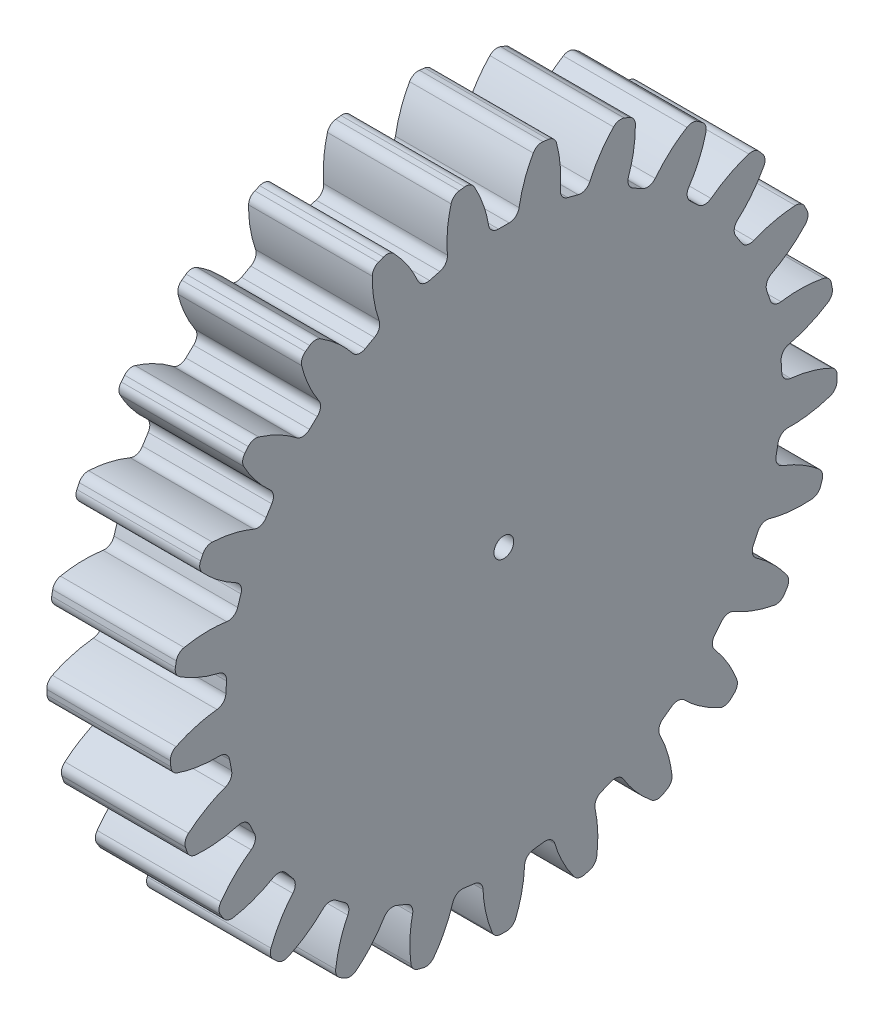
from build123d import *

# Parameters (mm, degrees)
METRIC_SPUR_GEAR_1M_25T_14_5PA_1FW_OUT_R = 0.4
METRIC_SPUR_GEAR_1M_25T_14_5PA_1FW_DEPTH = 1
ADD25_R                                  = 0.4
DED25A_R                                 = 0.4
DED25B_R                                 = 0.4
SCALE25_SCALE_X                          = 10
SCALE25_SCALE_Y                          = 2
SCALE25_SCALE_Z                          = 2


# Read off the part's stored shape, not the designer's step: Solid Bodies9
with BuildPart() as part:
    # Metric - Spur gear 1M 25T 14.5PA 1FW ---S25N75H50L0.8N out → Metric - Spur gear 1M 25T 14.5PA 1FW ---S25N75H50L0.8N (new body)
    with BuildSketch(Plane.YZ):
        with BuildLine():
            ThreePointArc((12.411863853, -5.309956279), (12.551982559, -4.969681461), (12.68277456, -4.62571394))
            ThreePointArc((12.68277456, -4.62571394), (11.786600969, -3.871668557), (10.739601079, -3.346784973))
            ThreePointArc((10.739601079, -3.346784973), (10.89559198, -2.79751254), (11.023510124, -2.241032249))
            ThreePointArc((11.023510124, -2.241032249), (12.193867716, -2.285469303), (13.342454754, -2.056429217))
            ThreePointArc((13.342454754, -2.056429217), (13.393548468, -1.691998653), (13.434690153, -1.326310856))
            ThreePointArc((13.434690153, -1.326310856), (12.379148042, -0.818824505), (11.23450834, -0.570809389))
            ThreePointArc((11.23450834, -0.570809389), (11.249, 0), (11.23450834, 0.570809389))
            ThreePointArc((11.23450834, 0.570809389), (12.379148042, 0.818824505), (13.434690153, 1.326310856))
            ThreePointArc((13.434690153, 1.326310856), (13.393548468, 1.691998653), (13.342454754, 2.056429217))
            ThreePointArc((13.342454754, 2.056429217), (12.193867716, 2.285469303), (11.023510124, 2.241032249))
            ThreePointArc((11.023510124, 2.241032249), (10.89559198, 2.79751254), (10.739601079, 3.346784973))
            ThreePointArc((10.739601079, 3.346784973), (11.786600969, 3.871668557), (12.68277456, 4.62571394))
            ThreePointArc((12.68277456, 4.62571394), (12.551982559, 4.969681461), (12.411863853, 5.309956279))
            ThreePointArc((12.411863853, 5.309956279), (11.242401836, 5.246158668), (10.119864226, 4.912061589))
            ThreePointArc((10.119864226, 4.912061589), (9.857573844, 5.41924708), (9.569885185, 5.91246975))
            ThreePointArc((9.569885185, 5.91246975), (10.453458409, 6.681241435), (11.133953598, 7.634466404))
            ThreePointArc((11.133953598, 7.634466404), (10.921729424, 7.935100906), (10.701389899, 8.229839259))
            ThreePointArc((10.701389899, 8.229839259), (9.584534502, 7.877212591), (8.580350039, 7.274448034))
            ThreePointArc((8.580350039, 7.274448034), (8.20016809, 7.700470395), (7.798858209, 8.106652307))
            ThreePointArc((7.798858209, 8.106652307), (8.463486612, 9.071007341), (8.885545383, 10.163517267))
            ThreePointArc((8.885545383, 10.163517267), (8.605223862, 10.401928777), (8.31850826, 10.632611172))
            ThreePointArc((8.31850826, 10.632611172), (7.324435615, 10.013312276), (6.501700904, 9.179754155))
            ThreePointArc((6.501700904, 9.179754155), (6.027515617, 9.497844834), (5.53780029, 9.791464086))
            ThreePointArc((5.53780029, 9.791464086), (5.941722825, 10.890808496), (6.078825673, 12.053956962))
            ThreePointArc((6.078825673, 12.053956962), (5.748020436, 12.215165208), (5.412944153, 12.36729702))
            ThreePointArc((5.412944153, 12.36729702), (4.604115502, 11.520238724), (4.014525989, 10.508262563))
            ThreePointArc((4.014525989, 10.508262563), (3.47613217, 10.698434752), (2.928782012, 10.861042166))
            ThreePointArc((2.928782012, 10.861042166), (3.04661874, 12.026300099), (2.89015099, 13.187002209))
            ThreePointArc((2.89015099, 13.187002209), (2.529647747, 13.260877885), (2.167264859, 13.324900113))
            ThreePointArc((2.167264859, 13.324900113), (1.594501878, 12.303306205), (1.275103642, 11.176498186))
            ThreePointArc((1.275103642, 11.176498186), (0.706330554, 11.226802668), (0.135737589, 11.248181022))
            ThreePointArc((0.135737589, 11.248181022), (-0.039915605, 12.406135037), (-0.48012251, 13.491459609))
            ThreePointArc((-0.48012251, 13.491459609), (-0.847672014, 13.473360834), (-1.214591658, 13.445250727))
            ThreePointArc((-1.214591658, 13.445250727), (-1.515300162, 12.313311709), (-1.544438156, 11.142473324))
            ThreePointArc((-1.544438156, 11.142473324), (-2.107852408, 11.049749283), (-2.665835727, 10.928555297))
            ThreePointArc((-2.665835727, 10.928555297), (-3.123941905, 12.006446884), (-3.820228146, 12.948198983))
            ThreePointArc((-3.820228146, 12.948198983), (-4.171729424, 12.83926297), (-4.520130914, 12.720786789))
            ThreePointArc((-4.520130914, 12.720786789), (-4.529890321, 11.549626552), (-4.266937225, 10.408325884))
            ThreePointArc((-4.266937225, 10.408325884), (-4.789591251, 10.178399513), (-5.299904779, 9.92224825))
            ThreePointArc((-5.299904779, 9.92224825), (-6.011679447, 10.852349517), (-6.920294798, 11.591355396))
            ThreePointArc((-6.920294798, 11.591355396), (-7.233661732, 11.398426994), (-7.54165372, 11.197029033))
            ThreePointArc((-7.54165372, 11.197029033), (-7.25985081, 10.060235883), (-6.721328936, 9.02018505))
            ThreePointArc((-6.721328936, 9.02018505), (-7.170382461, 8.667503468), (-7.600961322, 8.292489854))
            ThreePointArc((-7.600961322, 8.292489854), (-8.521681059, 9.016359118), (-9.585533877, 9.506184318))
            ThreePointArc((-9.585533877, 9.506184318), (-9.84107647, 9.24138593), (-10.089306687, 8.969720763))
            ThreePointArc((-10.089306687, 8.969720763), (-9.533648174, 7.938723595), (-8.75339483, 7.065272815))
            ThreePointArc((-8.75339483, 7.065272815), (-9.10063217, 6.611996303), (-9.424421511, 6.141683823))
            ThreePointArc((-9.424421511, 6.141683823), (-10.49623411, 6.613837715), (-11.648478609, 6.823704719))
            ThreePointArc((-11.648478609, 6.823704719), (-11.830140181, 6.503674601), (-12.003011409, 6.17881195))
            ThreePointArc((-12.003011409, 6.17881195), (-11.20841136, 5.318392106), (-10.235452734, 4.666423505))
            ThreePointArc((-10.235452734, 4.666423505), (-10.45905569, 4.141033093), (-10.655710636, 3.60497321))
            ThreePointArc((-10.655710636, 3.60497321), (-11.811270169, 3.795744565), (-12.97950659, 3.712466657))
            ThreePointArc((-12.97950659, 3.712466657), (-13.075872675, 3.357313477), (-13.16252278, 2.999665657))
            ThreePointArc((-13.16252278, 2.999665657), (-12.178908839, 2.363886482), (-11.0743795, 1.974365644))
            ThreePointArc((-11.0743795, 1.974365644), (-11.160298275, 1.409873545), (-11.217462273, 0.841748872))
            ThreePointArc((-11.217462273, 0.841748872), (-12.384160685, 0.739150824), (-13.494984437, 0.36796066))
            ThreePointArc((-13.494984437, 0.36796066), (-13.5, 0), (-13.494984437, -0.36796066))
            ThreePointArc((-13.494984437, -0.36796066), (-12.384160685, -0.739150824), (-11.217462273, -0.841748872))
            ThreePointArc((-11.217462273, -0.841748872), (-11.160298275, -1.409873545), (-11.0743795, -1.974365644))
            ThreePointArc((-11.0743795, -1.974365644), (-12.178908839, -2.363886482), (-13.16252278, -2.999665657))
            ThreePointArc((-13.16252278, -2.999665657), (-13.075872675, -3.357313477), (-12.97950659, -3.712466657))
            ThreePointArc((-12.97950659, -3.712466657), (-11.811270169, -3.795744565), (-10.655710636, -3.60497321))
            ThreePointArc((-10.655710636, -3.60497321), (-10.45905569, -4.141033093), (-10.235452734, -4.666423505))
            ThreePointArc((-10.235452734, -4.666423505), (-11.20841136, -5.318392106), (-12.003011409, -6.17881195))
            ThreePointArc((-12.003011409, -6.17881195), (-11.830140181, -6.503674601), (-11.648478609, -6.823704719))
            ThreePointArc((-11.648478609, -6.823704719), (-10.49623411, -6.613837715), (-9.424421511, -6.141683823))
            ThreePointArc((-9.424421511, -6.141683823), (-9.10063217, -6.611996303), (-8.75339483, -7.065272815))
            ThreePointArc((-8.75339483, -7.065272815), (-9.533648174, -7.938723595), (-10.089306687, -8.969720763))
            ThreePointArc((-10.089306687, -8.969720763), (-9.84107647, -9.24138593), (-9.585533877, -9.506184318))
            ThreePointArc((-9.585533877, -9.506184318), (-8.521681059, -9.016359118), (-7.600961322, -8.292489854))
            ThreePointArc((-7.600961322, -8.292489854), (-7.170382461, -8.667503468), (-6.721328936, -9.02018505))
            ThreePointArc((-6.721328936, -9.02018505), (-7.25985081, -10.060235883), (-7.54165372, -11.197029033))
            ThreePointArc((-7.54165372, -11.197029033), (-7.233661732, -11.398426994), (-6.920294798, -11.591355396))
            ThreePointArc((-6.920294798, -11.591355396), (-6.011679447, -10.852349517), (-5.299904779, -9.92224825))
            ThreePointArc((-5.299904779, -9.92224825), (-4.789591251, -10.178399513), (-4.266937225, -10.408325884))
            ThreePointArc((-4.266937225, -10.408325884), (-4.529890321, -11.549626552), (-4.520130914, -12.720786789))
            ThreePointArc((-4.520130914, -12.720786789), (-4.171729424, -12.83926297), (-3.820228146, -12.948198983))
            ThreePointArc((-3.820228146, -12.948198983), (-3.123941905, -12.006446884), (-2.665835727, -10.928555297))
            ThreePointArc((-2.665835727, -10.928555297), (-2.107852408, -11.049749283), (-1.544438156, -11.142473324))
            ThreePointArc((-1.544438156, -11.142473324), (-1.515300162, -12.313311709), (-1.214591658, -13.445250727))
            ThreePointArc((-1.214591658, -13.445250727), (-0.847672014, -13.473360834), (-0.48012251, -13.491459609))
            ThreePointArc((-0.48012251, -13.491459609), (-0.039915605, -12.406135037), (0.135737589, -11.248181022))
            ThreePointArc((0.135737589, -11.248181022), (0.706330554, -11.226802668), (1.275103642, -11.176498186))
            ThreePointArc((1.275103642, -11.176498186), (1.594501878, -12.303306205), (2.167264859, -13.324900113))
            ThreePointArc((2.167264859, -13.324900113), (2.529647747, -13.260877885), (2.89015099, -13.187002209))
            ThreePointArc((2.89015099, -13.187002209), (3.04661874, -12.026300099), (2.928782012, -10.861042166))
            ThreePointArc((2.928782012, -10.861042166), (3.47613217, -10.698434752), (4.014525989, -10.508262563))
            ThreePointArc((4.014525989, -10.508262563), (4.604115502, -11.520238724), (5.412944153, -12.36729702))
            ThreePointArc((5.412944153, -12.36729702), (5.748020436, -12.215165208), (6.078825673, -12.053956962))
            ThreePointArc((6.078825673, -12.053956962), (5.941722825, -10.890808496), (5.53780029, -9.791464086))
            ThreePointArc((5.53780029, -9.791464086), (6.027515617, -9.497844834), (6.501700904, -9.179754155))
            ThreePointArc((6.501700904, -9.179754155), (7.324435615, -10.013312276), (8.31850826, -10.632611172))
            ThreePointArc((8.31850826, -10.632611172), (8.605223862, -10.401928777), (8.885545383, -10.163517267))
            ThreePointArc((8.885545383, -10.163517267), (8.463486612, -9.071007341), (7.798858209, -8.106652307))
            ThreePointArc((7.798858209, -8.106652307), (8.20016809, -7.700470395), (8.580350039, -7.274448034))
            ThreePointArc((8.580350039, -7.274448034), (9.584534502, -7.877212591), (10.701389899, -8.229839259))
            ThreePointArc((10.701389899, -8.229839259), (10.921729424, -7.935100906), (11.133953598, -7.634466404))
            ThreePointArc((11.133953598, -7.634466404), (10.453458409, -6.681241435), (9.569885185, -5.91246975))
            ThreePointArc((9.569885185, -5.91246975), (9.857573844, -5.41924708), (10.119864226, -4.912061589))
            ThreePointArc((10.119864226, -4.912061589), (11.242401836, -5.246158668), (12.411863853, -5.309956279))
        make_face()
        Circle(METRIC_SPUR_GEAR_1M_25T_14_5PA_1FW_OUT_R, mode=Mode.SUBTRACT)
    extrude(amount=METRIC_SPUR_GEAR_1M_25T_14_5PA_1FW_DEPTH)

    # Add25
    add25_edges = [part.edges().sort_by_distance(p)[0] for p in [
        (0.5, 5.412944153, 12.36729702),
        (0.5, 2.89015099, 13.187002209),
        (0.5, 2.167264859, 13.324900113),
        (0.5, -0.48012251, 13.491459609),
        (0.5, -1.214591658, 13.445250727),
        (0.5, -3.820228146, 12.948198983),
        (0.5, 13.434690153, -1.326310856),
        (0.5, 13.434690153, 1.326310856),
        (0.5, -4.520130914, 12.720786789),
        (0.5, -6.920294798, 11.591355396),
        (0.5, -7.54165372, 11.197029033),
        (0.5, -9.585533877, 9.506184318),
        (0.5, -10.089306687, 8.969720763),
        (0.5, -11.648478609, 6.823704719),
        (0.5, -12.003011409, 6.17881195),
        (0.5, -12.97950659, 3.712466657),
        (0.5, -13.16252278, 2.999665657),
        (0.5, -13.494984437, 0.36796066),
        (0.5, -13.494984437, -0.36796066),
        (0.5, -13.16252278, -2.999665657),
        (0.5, -12.97950659, -3.712466657),
        (0.5, -12.003011409, -6.17881195),
        (0.5, -11.648478609, -6.823704719),
        (0.5, -10.089306687, -8.969720763),
        (0.5, -9.585533877, -9.506184318),
        (0.5, -7.54165372, -11.197029033),
        (0.5, -6.920294798, -11.591355396),
        (0.5, -4.520130914, -12.720786789),
        (0.5, 13.342454754, 2.056429217),
        (0.5, -3.820228146, -12.948198983),
        (0.5, -1.214591658, -13.445250727),
        (0.5, 12.68277456, 4.62571394),
        (0.5, -0.48012251, -13.491459609),
        (0.5, 2.167264859, -13.324900113),
        (0.5, 2.89015099, -13.187002209),
        (0.5, 5.412944153, -12.36729702),
        (0.5, 6.078825673, -12.053956962),
        (0.5, 8.31850826, -10.632611172),
        (0.5, 8.885545383, -10.163517267),
        (0.5, 10.701389899, -8.229839259),
        (0.5, 11.133953598, -7.634466404),
        (0.5, 12.411863853, -5.309956279),
        (0.5, 12.68277456, -4.62571394),
        (0.5, 13.342454754, -2.056429217),
        (0.5, 12.411863853, 5.309956279),
        (0.5, 11.133953598, 7.634466404),
        (0.5, 10.701389899, 8.229839259),
        (0.5, 8.885545383, 10.163517267),
        (0.5, 8.31850826, 10.632611172),
        (0.5, 6.078825673, 12.053956962),
    ]]
    fillet(add25_edges, radius=ADD25_R)

    # Ded25a
    ded25a_edges = [part.edges().sort_by_distance(p)[0] for p in [
        (0.5, 2.928782012, 10.861042166),
        (0.5, 0.135737589, 11.248181022),
        (0.5, -2.665835727, 10.928555297),
        (0.5, -5.299904779, 9.92224825),
        (0.5, 11.23450834, 0.570809389),
        (0.5, -7.600961322, 8.292489854),
        (0.5, -9.424421511, 6.141683823),
        (0.5, -10.655710636, 3.60497321),
        (0.5, -11.217462273, 0.841748872),
        (0.5, -11.0743795, -1.974365644),
        (0.5, -10.235452734, -4.666423505),
        (0.5, -8.75339483, -7.065272815),
        (0.5, -6.721328936, -9.02018505),
        (0.5, -4.266937225, -10.408325884),
        (0.5, -1.544438156, -11.142473324),
        (0.5, 10.739601079, 3.346784973),
        (0.5, 1.275103642, -11.176498186),
        (0.5, 4.014525989, -10.508262563),
        (0.5, 6.501700904, -9.179754155),
        (0.5, 8.580350039, -7.274448034),
        (0.5, 10.119864226, -4.912061589),
        (0.5, 11.023510124, -2.241032249),
        (0.5, 9.569885185, 5.91246975),
        (0.5, 7.798858209, 8.106652307),
        (0.5, 5.53780029, 9.791464086),
    ]]
    fillet(ded25a_edges, radius=DED25A_R)

    # Ded25b
    ded25b_edges = [part.edges().sort_by_distance(p)[0] for p in [
        (0.5, 4.014525989, 10.508262563),
        (0.5, 1.275103642, 11.176498186),
        (0.5, 11.23450834, -0.570809389),
        (0.5, -1.544438156, 11.142473324),
        (0.5, -4.266937225, 10.408325884),
        (0.5, -6.721328936, 9.02018505),
        (0.5, -8.75339483, 7.065272815),
        (0.5, -10.235452734, 4.666423505),
        (0.5, -11.0743795, 1.974365644),
        (0.5, -11.217462273, -0.841748872),
        (0.5, -10.655710636, -3.60497321),
        (0.5, -9.424421511, -6.141683823),
        (0.5, -7.600961322, -8.292489854),
        (0.5, -5.299904779, -9.92224825),
        (0.5, 11.023510124, 2.241032249),
        (0.5, -2.665835727, -10.928555297),
        (0.5, 0.135737589, -11.248181022),
        (0.5, 2.928782012, -10.861042166),
        (0.5, 5.53780029, -9.791464086),
        (0.5, 7.798858209, -8.106652307),
        (0.5, 9.569885185, -5.91246975),
        (0.5, 10.739601079, -3.346784973),
        (0.5, 10.119864226, 4.912061589),
        (0.5, 8.580350039, 7.274448034),
        (0.5, 6.501700904, 9.179754155),
    ]]
    fillet(ded25b_edges, radius=DED25B_R)


with BuildPart() as part_1:
    # Scale25: scaled about (0.5, 0, 0)
    add(part.part.scale((SCALE25_SCALE_X, SCALE25_SCALE_Y, SCALE25_SCALE_Z), about=(0.5, 0, 0)))


solid = part_1.part
